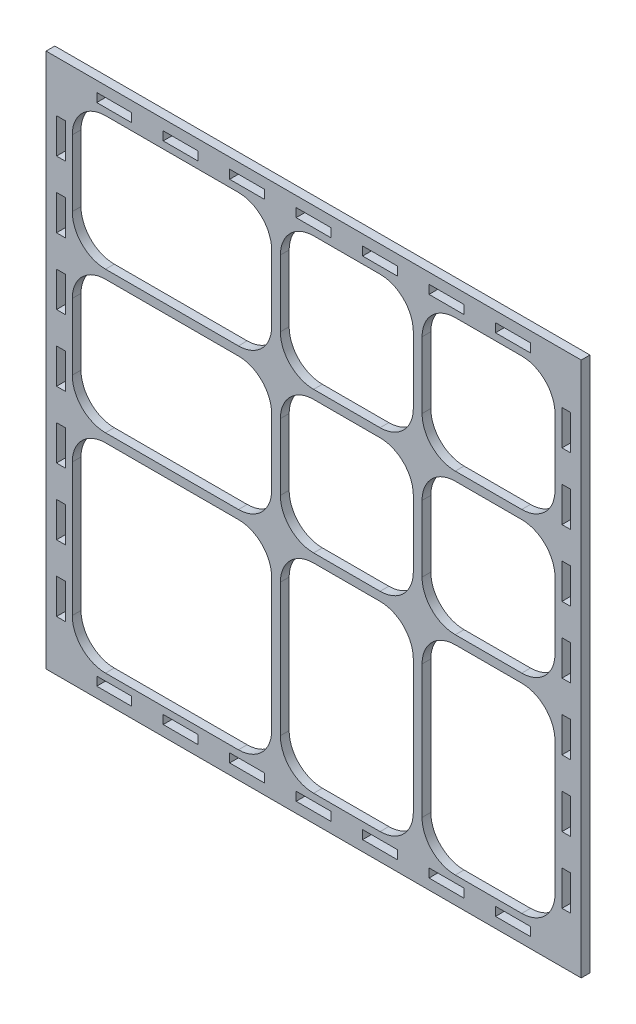
from build123d import *

# Parameters (mm, degrees)
SKETCH1_3_W         = 153
SKETCH1_3_H         = 153
SKETCH1_3_W_2       = 10
SKETCH1_3_H_2       = 2.5
SKETCH1_3_W_3       = 2.5
SKETCH1_3_H_3       = 10
BOSS_EXTRUDE2_DEPTH = 2.5


with BuildPart() as part:
    # Sketch1<3> → Boss-Extrude2 (new body)
    with BuildSketch(Plane.XY):
        Rectangle(SKETCH1_3_W, SKETCH1_3_H)
        with Locations((-57, -72.25)):
            Rectangle(SKETCH1_3_W_2, SKETCH1_3_H_2, mode=Mode.SUBTRACT)
        with Locations((-72.25, -57)):
            Rectangle(SKETCH1_3_W_3, SKETCH1_3_H_3, mode=Mode.SUBTRACT)
        with BuildLine():
            ThreePointArc((-69.003130736, -21.503130736), (-66.220645157, -14.785616314), (-59.503130736, -12.003130736))
            Line((-59.503130736, -12.003130736), (-21.503130736, -12.003130736))
            ThreePointArc((-21.503130736, -12.003130736), (-14.785616314, -14.785616314), (-12.003130736, -21.503130736))
            Line((-12.003130736, -21.503130736), (-12.003130736, -59.503130736))
            ThreePointArc((-12.003130736, -59.503130736), (-14.785616314, -66.220645157), (-21.503130736, -69.003130736))
            Line((-21.503130736, -69.003130736), (-59.503130736, -69.003130736))
            ThreePointArc((-59.503130736, -69.003130736), (-66.220645157, -66.220645157), (-69.003130736, -59.503130736))
            Line((-69.003130736, -59.503130736), (-69.003130736, -21.503130736))
        make_face(mode=Mode.SUBTRACT)
        with Locations((-38, -72.25)):
            Rectangle(SKETCH1_3_W_2, SKETCH1_3_H_2, mode=Mode.SUBTRACT)
        with Locations((-19, -72.25)):
            Rectangle(SKETCH1_3_W_2, SKETCH1_3_H_2, mode=Mode.SUBTRACT)
        with Locations((0, -72.25)):
            Rectangle(SKETCH1_3_W_2, SKETCH1_3_H_2, mode=Mode.SUBTRACT)
        with Locations((-72.25, -38)):
            Rectangle(SKETCH1_3_W_3, SKETCH1_3_H_3, mode=Mode.SUBTRACT)
        with Locations((-72.25, -19)):
            Rectangle(SKETCH1_3_W_3, SKETCH1_3_H_3, mode=Mode.SUBTRACT)
        with Locations((19, -72.25)):
            Rectangle(SKETCH1_3_W_2, SKETCH1_3_H_2, mode=Mode.SUBTRACT)
        with Locations((38, -72.25)):
            Rectangle(SKETCH1_3_W_2, SKETCH1_3_H_2, mode=Mode.SUBTRACT)
        with BuildLine():
            Line((-9.503130736, -59.503130736), (-9.503130736, -21.503130736))
            ThreePointArc((-9.503130736, -21.503130736), (-6.720645157, -14.785616314), (-0.003130736, -12.003130736))
            Line((-0.003130736, -12.003130736), (18.996869264, -12.003130736))
            ThreePointArc((18.996869264, -12.003130736), (25.714383686, -14.785616314), (28.496869264, -21.503130736))
            Line((28.496869264, -21.503130736), (28.496869264, -59.503130736))
            ThreePointArc((28.496869264, -59.503130736), (25.714383686, -66.220645157), (18.996869264, -69.003130736))
            Line((18.996869264, -69.003130736), (-0.003130736, -69.003130736))
            ThreePointArc((-0.003130736, -69.003130736), (-6.720645157, -66.220645157), (-9.503130736, -59.503130736))
        make_face(mode=Mode.SUBTRACT)
        with Locations((57, -72.25)):
            Rectangle(SKETCH1_3_W_2, SKETCH1_3_H_2, mode=Mode.SUBTRACT)
        with BuildLine():
            ThreePointArc((30.996869264, -21.503130736), (33.779354843, -14.785616314), (40.496869264, -12.003130736))
            Line((40.496869264, -12.003130736), (59.496869264, -12.003130736))
            ThreePointArc((59.496869264, -12.003130736), (66.214383686, -14.785616314), (68.996869264, -21.503130736))
            Line((68.996869264, -21.503130736), (68.996869264, -59.503130736))
            ThreePointArc((68.996869264, -59.503130736), (66.214383686, -66.220645157), (59.496869264, -69.003130736))
            Line((59.496869264, -69.003130736), (40.496869264, -69.003130736))
            ThreePointArc((40.496869264, -69.003130736), (33.779354843, -66.220645157), (30.996869264, -59.503130736))
            Line((30.996869264, -59.503130736), (30.996869264, -21.503130736))
        make_face(mode=Mode.SUBTRACT)
        with Locations((72.25, -57)):
            Rectangle(SKETCH1_3_W_3, SKETCH1_3_H_3, mode=Mode.SUBTRACT)
        with Locations((72.25, -38)):
            Rectangle(SKETCH1_3_W_3, SKETCH1_3_H_3, mode=Mode.SUBTRACT)
        with Locations((72.25, -19)):
            Rectangle(SKETCH1_3_W_3, SKETCH1_3_H_3, mode=Mode.SUBTRACT)
        with Locations((-72.25, 0)):
            Rectangle(SKETCH1_3_W_3, SKETCH1_3_H_3, mode=Mode.SUBTRACT)
        with Locations((-72.25, 19)):
            Rectangle(SKETCH1_3_W_3, SKETCH1_3_H_3, mode=Mode.SUBTRACT)
        with BuildLine():
            Line((-69.003130736, -0.003130736), (-69.003130736, 18.996869264))
            ThreePointArc((-69.003130736, 18.996869264), (-66.220645157, 25.714383686), (-59.503130736, 28.496869264))
            Line((-59.503130736, 28.496869264), (-21.503130736, 28.496869264))
            ThreePointArc((-21.503130736, 28.496869264), (-14.785616314, 25.714383686), (-12.003130736, 18.996869264))
            Line((-12.003130736, 18.996869264), (-12.003130736, -0.003130736))
            ThreePointArc((-12.003130736, -0.003130736), (-14.785616314, -6.720645157), (-21.503130736, -9.503130736))
            Line((-21.503130736, -9.503130736), (-59.503130736, -9.503130736))
            ThreePointArc((-59.503130736, -9.503130736), (-66.220645157, -6.720645157), (-69.003130736, -0.003130736))
        make_face(mode=Mode.SUBTRACT)
        with Locations((-72.25, 38)):
            Rectangle(SKETCH1_3_W_3, SKETCH1_3_H_3, mode=Mode.SUBTRACT)
        with Locations((-72.25, 57)):
            Rectangle(SKETCH1_3_W_3, SKETCH1_3_H_3, mode=Mode.SUBTRACT)
        with BuildLine():
            ThreePointArc((-69.003130736, 59.496869264), (-66.220645157, 66.214383686), (-59.503130736, 68.996869264))
            Line((-59.503130736, 68.996869264), (-21.503130736, 68.996869264))
            ThreePointArc((-21.503130736, 68.996869264), (-14.785616314, 66.214383686), (-12.003130736, 59.496869264))
            Line((-12.003130736, 59.496869264), (-12.003130736, 40.496869264))
            ThreePointArc((-12.003130736, 40.496869264), (-14.785616314, 33.779354843), (-21.503130736, 30.996869264))
            Line((-21.503130736, 30.996869264), (-59.503130736, 30.996869264))
            ThreePointArc((-59.503130736, 30.996869264), (-66.220645157, 33.779354843), (-69.003130736, 40.496869264))
            Line((-69.003130736, 40.496869264), (-69.003130736, 59.496869264))
        make_face(mode=Mode.SUBTRACT)
        with Locations((-57, 72.25)):
            Rectangle(SKETCH1_3_W_2, SKETCH1_3_H_2, mode=Mode.SUBTRACT)
        with Locations((-38, 72.25)):
            Rectangle(SKETCH1_3_W_2, SKETCH1_3_H_2, mode=Mode.SUBTRACT)
        with Locations((-19, 72.25)):
            Rectangle(SKETCH1_3_W_2, SKETCH1_3_H_2, mode=Mode.SUBTRACT)
        with Locations((0, 72.25)):
            Rectangle(SKETCH1_3_W_2, SKETCH1_3_H_2, mode=Mode.SUBTRACT)
        with BuildLine():
            Line((-9.503130736, -0.003130736), (-9.503130736, 18.996869264))
            ThreePointArc((-9.503130736, 18.996869264), (-6.720645157, 25.714383686), (-0.003130736, 28.496869264))
            Line((-0.003130736, 28.496869264), (18.996869264, 28.496869264))
            ThreePointArc((18.996869264, 28.496869264), (25.714383686, 25.714383686), (28.496869264, 18.996869264))
            Line((28.496869264, 18.996869264), (28.496869264, -0.003130736))
            ThreePointArc((28.496869264, -0.003130736), (25.714383686, -6.720645157), (18.996869264, -9.503130736))
            Line((18.996869264, -9.503130736), (-0.003130736, -9.503130736))
            ThreePointArc((-0.003130736, -9.503130736), (-6.720645157, -6.720645157), (-9.503130736, -0.003130736))
        make_face(mode=Mode.SUBTRACT)
        with BuildLine():
            Line((31, -0.003130736), (31, 18.996869264))
            ThreePointArc((31, 18.996869264), (33.782485579, 25.714383686), (40.5, 28.496869264))
            Line((40.5, 28.496869264), (59.5, 28.496869264))
            ThreePointArc((59.5, 28.496869264), (66.217514421, 25.714383686), (69, 18.996869264))
            Line((69, 18.996869264), (69, -0.003130736))
            ThreePointArc((69, -0.003130736), (66.217514421, -6.720645157), (59.5, -9.503130736))
            Line((59.5, -9.503130736), (40.5, -9.503130736))
            ThreePointArc((40.5, -9.503130736), (33.782485579, -6.720645157), (31, -0.003130736))
        make_face(mode=Mode.SUBTRACT)
        with Locations((72.25, 0)):
            Rectangle(SKETCH1_3_W_3, SKETCH1_3_H_3, mode=Mode.SUBTRACT)
        with Locations((72.25, 19)):
            Rectangle(SKETCH1_3_W_3, SKETCH1_3_H_3, mode=Mode.SUBTRACT)
        with Locations((72.25, 38)):
            Rectangle(SKETCH1_3_W_3, SKETCH1_3_H_3, mode=Mode.SUBTRACT)
        with BuildLine():
            Line((-9.503130736, 40.496869264), (-9.503130736, 59.496869264))
            ThreePointArc((-9.503130736, 59.496869264), (-6.720645157, 66.214383686), (-0.003130736, 68.996869264))
            Line((-0.003130736, 68.996869264), (18.996869264, 68.996869264))
            ThreePointArc((18.996869264, 68.996869264), (25.714383686, 66.214383686), (28.496869264, 59.496869264))
            Line((28.496869264, 59.496869264), (28.496869264, 40.496869264))
            ThreePointArc((28.496869264, 40.496869264), (25.714383686, 33.779354843), (18.996869264, 30.996869264))
            Line((18.996869264, 30.996869264), (-0.003130736, 30.996869264))
            ThreePointArc((-0.003130736, 30.996869264), (-6.720645157, 33.779354843), (-9.503130736, 40.496869264))
        make_face(mode=Mode.SUBTRACT)
        with Locations((19, 72.25)):
            Rectangle(SKETCH1_3_W_2, SKETCH1_3_H_2, mode=Mode.SUBTRACT)
        with Locations((38, 72.25)):
            Rectangle(SKETCH1_3_W_2, SKETCH1_3_H_2, mode=Mode.SUBTRACT)
        with BuildLine():
            ThreePointArc((31, 59.5), (33.782485579, 66.217514421), (40.5, 69))
            Line((40.5, 69), (59.5, 69))
            ThreePointArc((59.5, 69), (66.217514421, 66.217514421), (69, 59.5))
            Line((69, 59.5), (69, 40.5))
            ThreePointArc((69, 40.5), (66.217514421, 33.782485579), (59.5, 31))
            Line((59.5, 31), (40.5, 31))
            ThreePointArc((40.5, 31), (33.782485579, 33.782485579), (31, 40.5))
            Line((31, 40.5), (31, 59.5))
        make_face(mode=Mode.SUBTRACT)
        with Locations((72.25, 57)):
            Rectangle(SKETCH1_3_W_3, SKETCH1_3_H_3, mode=Mode.SUBTRACT)
        with Locations((57, 72.25)):
            Rectangle(SKETCH1_3_W_2, SKETCH1_3_H_2, mode=Mode.SUBTRACT)
    extrude(amount=BOSS_EXTRUDE2_DEPTH)


solid = part.part
